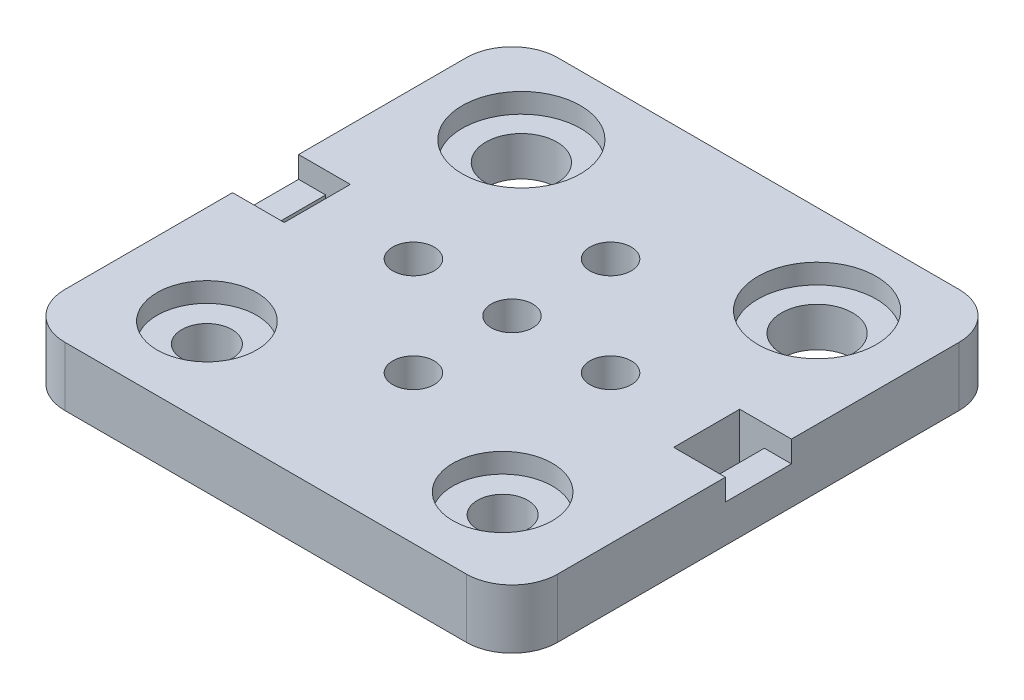
from build123d import *

# Parameters (mm, degrees)
SKETCH1_R             = 3.6
SKETCH1_R_2           = 2.55
BOSS_EXTRUDE1_DEPTH   = 6
M5X0_8_TAPPED_HOLE1_D = 4.2
SKETCH2_R             = 6
SKETCH2_R_2           = 5.05
CUT_EXTRUDE1_DEPTH    = 2
SKETCH5_W             = 5.25
SKETCH5_H             = 6.7
CUT_EXTRUDE2_DEPTH    = 2.18
SKETCH6_W             = 2.5
SKETCH6_H             = 6.7
CUT_EXTRUDE3_DEPTH    = 36.561107969


with BuildPart() as part:
    # Sketch1 → Boss-Extrude1 (new body)
    with BuildSketch(Plane(origin=(0, 0, 0), x_dir=(1, 0, 0), z_dir=(0, 1, 0))):
        with BuildLine():
            Line((20.365, -25), (-20.365, -25))
            ThreePointArc((-20.365, -25), (-23.642439931, -23.642439931), (-25, -20.365))
            Line((-25, -20.365), (-25, 20.365))
            ThreePointArc((-25, 20.365), (-23.642439931, 23.642439931), (-20.365, 25))
            Line((-20.365, 25), (20.365, 25))
            ThreePointArc((20.365, 25), (23.642439931, 23.642439931), (25, 20.365))
            Line((25, 20.365), (25, -20.365))
            ThreePointArc((25, -20.365), (23.642439931, -23.642439931), (20.365, -25))
        make_face()
        with Locations((-15, 15.95)):
            Circle(SKETCH1_R, mode=Mode.SUBTRACT)
        with Locations((15, 15.95)):
            Circle(SKETCH1_R, mode=Mode.SUBTRACT)
        with Locations((15, -15.95)):
            Circle(SKETCH1_R_2, mode=Mode.SUBTRACT)
        with Locations((-15, -15.95)):
            Circle(SKETCH1_R_2, mode=Mode.SUBTRACT)
    extrude(amount=BOSS_EXTRUDE1_DEPTH)

    # M5x0.8 Tapped Hole1 (through all)
    with Locations(Plane(origin=(0, 6, 0), x_dir=(1, 0, 0), z_dir=(0, 1, 0))):
        with Locations((0, 10), (-10, 0), (0, 0), (0, -10), (10, 0)):
            Hole(M5X0_8_TAPPED_HOLE1_D / 2)

    # Sketch2 → Cut-Extrude1 (cut)
    with BuildSketch(Plane(origin=(0, 6, 0), x_dir=(1, 0, 0), z_dir=(0, 1, 0))):
        with Locations((-15, 15.95)):
            Circle(SKETCH2_R)
        with Locations((15, 15.95)):
            Circle(SKETCH2_R)
        with Locations((15, -15.95)):
            Circle(SKETCH2_R_2)
        with Locations((-15, -15.95)):
            Circle(SKETCH2_R_2)
    extrude(amount=-CUT_EXTRUDE1_DEPTH, mode=Mode.SUBTRACT)

    # Sketch5 → Cut-Extrude2 (cut)
    with BuildSketch(Plane(origin=(0, 6, 0), x_dir=(1, 0, 0), z_dir=(0, 1, 0))):
        with Locations((-22.375, 0)):
            Rectangle(SKETCH5_W, SKETCH5_H)
        with Locations((22.375, 0)):
            Rectangle(SKETCH5_W, SKETCH5_H)
    extrude(amount=-CUT_EXTRUDE2_DEPTH, mode=Mode.SUBTRACT)

    # Sketch6 → Cut-Extrude3 (cut, through all)
    with BuildSketch(Plane(origin=(0, 3.82, 0), x_dir=(1, 0, 0), z_dir=(0, 1, 0))):
        with Locations((-21, 0)):
            Rectangle(SKETCH6_W, SKETCH6_H)
        with Locations((21, 0)):
            Rectangle(SKETCH6_W, SKETCH6_H)
    extrude(amount=-CUT_EXTRUDE3_DEPTH, mode=Mode.SUBTRACT)


solid = part.part
